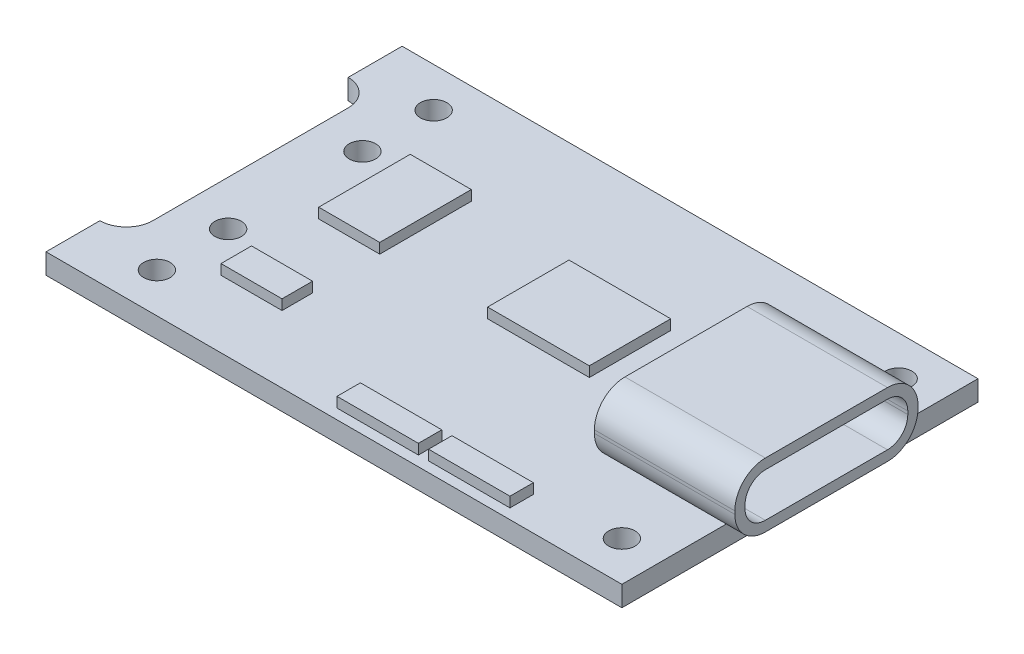
from build123d import *

# Parameters (mm, degrees)
CROQUIS1_R                = 0.65
SALIENTE_EXTRUIR1_DEPTH   = 1
CROQUIS2_W                = 6.9
CROQUIS2_H                = 9
SALIENTE_EXTRUIR2_DEPTH   = 3.15
REDONDEO1_R               = 1.5
VACIADO1_T                = -0.5
CROQUIS3_W                = 4
CROQUIS3_H                = 1.15
SALIENTE_EXTRUIR3_DEPTH   = 0.5
SALIENTE_EXTRUIR3_2_DEPTH = 0.5
CROQUIS4_W                = 3
CROQUIS4_H                = 1.5
SALIENTE_EXTRUIR4_DEPTH   = 0.5
CROQUIS4_H_2              = 4.5
SALIENTE_EXTRUIR4_2_DEPTH = 0.5
CROQUIS4_W_2              = 5
CROQUIS4_H_3              = 4
SALIENTE_EXTRUIR4_3_DEPTH = 0.5


with BuildPart() as part:
    # Croquis1 → Saliente-Extruir1 (new body)
    with BuildSketch(Plane(origin=(0, 0, 0), x_dir=(1, 0, 0), z_dir=(0, 1, 0))):
        with BuildLine():
            Line((-14.15, 8.75), (14.15, 8.75))
            Line((14.15, 8.75), (14.15, -8.75))
            Line((14.15, -8.75), (-14.15, -8.75))
            Line((-14.15, -8.75), (-14.15, -6.1))
            ThreePointArc((-14.15, -6.1), (-13.230761184, -5.719238816), (-12.85, -4.8))
            Line((-12.85, -4.8), (-12.85, 4.8))
            ThreePointArc((-12.85, 4.8), (-13.230761184, 5.719238816), (-14.15, 6.1))
            Line((-14.15, 6.1), (-14.15, 8.75))
        make_face()
        with Locations((12.2, 6.8)):
            Circle(CROQUIS1_R, mode=Mode.SUBTRACT)
        with Locations((12.2, -6.8)):
            Circle(CROQUIS1_R, mode=Mode.SUBTRACT)
        with Locations((-10.65, 6.8)):
            Circle(CROQUIS1_R, mode=Mode.SUBTRACT)
        with Locations((-10.65, 3.3)):
            Circle(CROQUIS1_R, mode=Mode.SUBTRACT)
        with Locations((-10.65, -3.3)):
            Circle(CROQUIS1_R, mode=Mode.SUBTRACT)
        with Locations((-10.65, -6.8)):
            Circle(CROQUIS1_R, mode=Mode.SUBTRACT)
    extrude(amount=SALIENTE_EXTRUIR1_DEPTH)


with BuildPart() as body_2:
    # Croquis2 → Saliente-Extruir2 (new body)
    with BuildSketch(Plane(origin=(0, 1, 0), x_dir=(1, 0, 0), z_dir=(0, 1, 0))):
        with Locations((12, 0)):
            Rectangle(CROQUIS2_W, CROQUIS2_H)
    extrude(amount=SALIENTE_EXTRUIR2_DEPTH)

    # Redondeo1
    redondeo1_edges = [body_2.edges().sort_by_distance(p)[0] for p in [
        (12, 1, -4.5),
        (12, 1, 4.5),
        (12, 4.15, 4.5),
        (12, 4.15, -4.5),
    ]]
    fillet(redondeo1_edges, radius=REDONDEO1_R)

    # Vaciado1
    vaciado1_openings = [body_2.faces().sort_by_distance(p)[0] for p in [
        (15.45, 2.575, 0),
    ]]
    offset(amount=VACIADO1_T, openings=vaciado1_openings, kind=Kind.INTERSECTION)


with BuildPart() as body_3:
    # Croquis3 → Saliente-Extruir3 (new body)
    with BuildSketch(Plane(origin=(0, 1, 0), x_dir=(1, 0, 0), z_dir=(0, 1, 0))):
        with Locations((1.65, -7.675)):
            Rectangle(CROQUIS3_W, CROQUIS3_H)
    extrude(amount=SALIENTE_EXTRUIR3_DEPTH)


with BuildPart() as body_4:
    # Croquis3 → Saliente-Extruir3 2 (new body)
    with BuildSketch(Plane(origin=(0, 1, 0), x_dir=(1, 0, 0), z_dir=(0, 1, 0))):
        with Locations((6.15, -7.675)):
            Rectangle(CROQUIS3_W, CROQUIS3_H)
    extrude(amount=SALIENTE_EXTRUIR3_2_DEPTH)


with BuildPart() as body_5:
    # Croquis4 → Saliente-Extruir4 (new body)
    with BuildSketch(Plane(origin=(0, 1, 0), x_dir=(1, 0, 0), z_dir=(0, 1, 0))):
        with Locations((-7.35, -4.7)):
            Rectangle(CROQUIS4_W, CROQUIS4_H)
    extrude(amount=SALIENTE_EXTRUIR4_DEPTH)


with BuildPart() as body_6:
    # Croquis4 → Saliente-Extruir4 2 (new body)
    with BuildSketch(Plane(origin=(0, 1, 0), x_dir=(1, 0, 0), z_dir=(0, 1, 0))):
        with Locations((-7.35, 1.6)):
            Rectangle(CROQUIS4_W, CROQUIS4_H_2)
    extrude(amount=SALIENTE_EXTRUIR4_2_DEPTH)


with BuildPart() as body_7:
    # Croquis4 → Saliente-Extruir4 3 (new body)
    with BuildSketch(Plane(origin=(0, 1, 0), x_dir=(1, 0, 0), z_dir=(0, 1, 0))):
        with Locations((2.05, 1.25)):
            Rectangle(CROQUIS4_W_2, CROQUIS4_H_3)
    extrude(amount=SALIENTE_EXTRUIR4_3_DEPTH)


solid = Compound([part.part, body_2.part, body_3.part, body_4.part, body_5.part, body_6.part, body_7.part])
